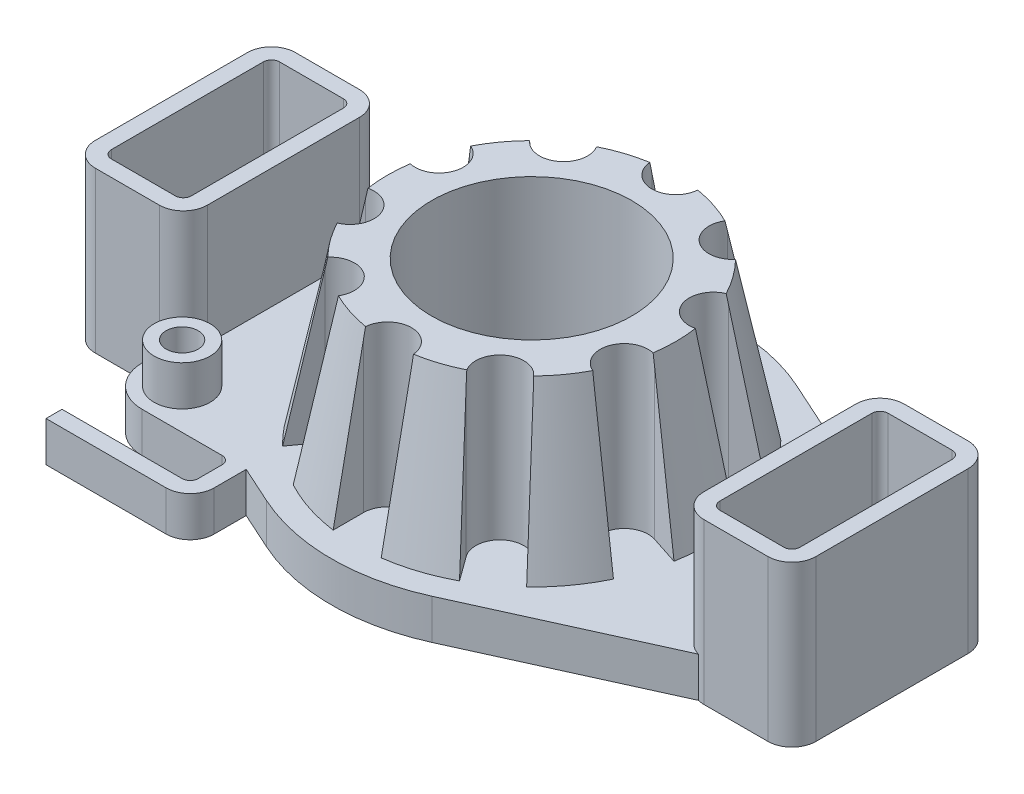
from build123d import *

# Parameters (mm, degrees)
SKETCH1_R               = 25
SKETCH1_R_2             = 12.5
SKETCH1_W               = 12
SKETCH1_H               = 25
BOSS_EXTRUDE1_DEPTH     = 5
CUT_EXTRUDE1_START      = -20
CUT_EXTRUDE1_DEPTH      = 20
CIRPATTERN1_COUNT       = 10
SKETCH4_W               = 14
SKETCH4_H               = 25
SKETCH4_W_2             = 10
SKETCH4_H_2             = 21
BOSS_EXTRUDE2_DEPTH     = 15
SKETCH4_3_W             = 10
SKETCH4_3_H             = 21
CUT_EXTRUDE4_DEPTH      = 56.226805122
BOSS_EXTRUDE3_DEPTH     = 5
FILLET1_R               = 3
FILLET2_R               = 1
FILLET3_R               = 5
SKETCH6_R               = 3.5
SKETCH6_R_2             = 2
BOSS_EXTRUDE4_DEPTH     = 10
CUT_EXTRUDE3_DEPTH      = 59.434495435
CUT_EXTRUDE3_DEPTH_BACK = 59.434495435
SKETCH6_2_R             = 2


# Read off the part's stored shape, not the designer's step: Cut-Extrude1
with BuildPart() as part:
    # Sketch1 → Boss-Extrude1 (new body)
    # profile 1 of 5: a face of its own
    with BuildSketch(Plane(origin=(0, 0, 0), x_dir=(1, 0, 0), z_dir=(0, 1, 0))):
        Circle(SKETCH1_R)
        with Locations(Location((0, 0, 0), (0, 0, 270))):
            Circle(SKETCH1_R_2, mode=Mode.SUBTRACT)
    # profile 2 of 5: a face of its own
    with BuildSketch(Plane(origin=(0, 0, 0), x_dir=(1, 0, 0), z_dir=(0, 1, 0))):
        with BuildLine():
            Line((33, 12.5), (10.312984639, 22.773720553))
            ThreePointArc((10.312984639, 22.773720553), (21.009814563, 13.549453569), (25, 0))
            ThreePointArc((25, 0), (21.009814563, -13.549453569), (10.312984639, -22.773720553))
            Line((10.312984639, -22.773720553), (33, -12.5))
            Line((33, -12.5), (33, 12.5))
        make_face()
    # profile 3 of 5: a face of its own
    with BuildSketch(Plane(origin=(0, 0, 0), x_dir=(1, 0, 0), z_dir=(0, 1, 0))):
        with Locations((39, 0)):
            Rectangle(SKETCH1_W, SKETCH1_H)
    # profile 4 of 5: a face of its own
    with BuildSketch(Plane(origin=(0, 0, 0), x_dir=(1, 0, 0), z_dir=(0, 1, 0))):
        with BuildLine():
            Line((-10.312984639, 22.773720553), (-33, 12.5))
            Line((-33, 12.5), (-33, -12.5))
            Line((-33, -12.5), (-10.312984639, -22.773720553))
            ThreePointArc((-10.312984639, -22.773720553), (-25, 0), (-10.312984639, 22.773720553))
        make_face()
    # profile 5 of 5: a face of its own
    with BuildSketch(Plane(origin=(0, 0, 0), x_dir=(1, 0, 0), z_dir=(0, 1, 0))):
        with Locations((-39, 0)):
            Rectangle(SKETCH1_W, SKETCH1_H)
    extrude(amount=BOSS_EXTRUDE1_DEPTH)

    # Sketch2 → Revolve1 (revolve)
    with BuildSketch(Plane.XY, mode=Mode.PRIVATE) as revolve1_sk:
        Polygon((12.5, 5), (12.5, 25), (18, 25), (22, 5), align=None)
    revolve(revolve1_sk.sketch.rotate(Axis((0, 0, 0), (0, 1, 0)), 90), axis=Axis((0, 0, 0), (0, 1, 0)))

    # Cut-Extrude1 outline → Cut-Extrude1 (cut)
    with BuildSketch(Plane(origin=(0, 25, 0), x_dir=(1, 0, 0), z_dir=(0, 1, 0)).offset(CUT_EXTRUDE1_START)):
        with BuildLine():
            ThreePointArc((-3, 18), (0, 15), (3, 18))
            Line((3, 18), (3, 22))
            Line((3, 22), (-3, 22))
            Line((-3, 22), (-3, 18))
        make_face()
    cut_extrude1 = extrude(amount=CUT_EXTRUDE1_DEPTH, mode=Mode.SUBTRACT)

    # CirPattern1: Cut-Extrude1 ×10 about axis
    cirpattern1_axis = Axis((0, 0, 0), (0, 1, 0))
    for i in range(1, CIRPATTERN1_COUNT):
        add(cut_extrude1.rotate(cirpattern1_axis, i * 360 / CIRPATTERN1_COUNT), mode=Mode.SUBTRACT)

    # Sketch4 → Boss-Extrude2 (add)
    # profile 1 of 2: a face of its own
    with BuildSketch(Plane(origin=(0, 5, 0), x_dir=(1, 0, 0), z_dir=(0, 1, 0))):
        with Locations((-38, 0)):
            Rectangle(SKETCH4_W, SKETCH4_H)
        with Locations((-38, 0)):
            Rectangle(SKETCH4_W_2, SKETCH4_H_2, mode=Mode.SUBTRACT)
    # profile 2 of 2: a face of its own
    with BuildSketch(Plane(origin=(0, 5, 0), x_dir=(1, 0, 0), z_dir=(0, 1, 0))):
        with Locations((38, 0)):
            Rectangle(SKETCH4_W, SKETCH4_H)
        with Locations((38, 0)):
            Rectangle(SKETCH4_W_2, SKETCH4_H_2, mode=Mode.SUBTRACT)
    extrude(amount=BOSS_EXTRUDE2_DEPTH)

    # Sketch4<3> → Cut-Extrude4 (cut, through all)
    with BuildSketch(Plane(origin=(0, 5, 0), x_dir=(1, 0, 0), z_dir=(0, 1, 0))):
        with Locations((-38, 0)):
            Rectangle(SKETCH4_3_W, SKETCH4_3_H)
        with Locations((38, 0)):
            Rectangle(SKETCH4_3_W, SKETCH4_3_H)
    extrude(amount=-CUT_EXTRUDE4_DEPTH, mode=Mode.SUBTRACT)

    # Sketch5 → Boss-Extrude3 (add)
    with BuildSketch(Plane(origin=(0, 0, 0), x_dir=(1, 0, 0), z_dir=(0, 1, 0))):
        Polygon((-33, -20.65122514), (-17, -20.65122514), (-17, -25.65122514), (-33, -25.65122514), (-33, -27.65122514), (-15, -27.65122514), (-15, -20.65122514), (-33, -12.5), align=None)
    extrude(amount=BOSS_EXTRUDE3_DEPTH)

    # Fillet1
    fillet1_edges = [part.edges().sort_by_distance(p)[0] for p in [
        (45, 10, -12.5),
        (45, 10, 12.5),
        (-45, 10, -12.5),
        (-45, 10, 12.5),
        (-15, 2.5, 27.65122514),
        (31, 12.5, 12.5),
        (31, 12.5, -12.5),
        (-31, 12.5, -12.5),
        (-31, 12.5, 12.5),
    ]]
    fillet(fillet1_edges, radius=FILLET1_R)

    # Fillet2
    fillet2_edges = [part.edges().sort_by_distance(p)[0] for p in [
        (-43, 10, -10.5),
        (-43, 10, 10.5),
        (-33, 10, 10.5),
        (-33, 10, -10.5),
        (33, 10, -10.5),
        (33, 10, 10.5),
        (43, 10, 10.5),
        (43, 10, -10.5),
        (-17, 2.5, 20.65122514),
        (-17, 2.5, 25.65122514),
    ]]
    fillet(fillet2_edges, radius=FILLET2_R)

    # Fillet3
    fillet3_edges = [part.edges().sort_by_distance(p)[0] for p in [
        (-33, 2.5, 20.65122514),
    ]]
    fillet(fillet3_edges, radius=FILLET3_R)

    # Sketch6 → Boss-Extrude4 (add)
    with BuildSketch(Plane(origin=(0, 0, 0), x_dir=(1, 0, 0), z_dir=(0, 1, 0))):
        with Locations(Location((-28, -15.65122514, 0), (0, 0, 270))):
            Circle(SKETCH6_R)
        with Locations(Location((-28, -15.65122514, 0), (0, 0, 270))):
            Circle(SKETCH6_R_2, mode=Mode.SUBTRACT)
    extrude(amount=BOSS_EXTRUDE4_DEPTH)

    # Sketch6<2> → Cut-Extrude3 (cut, two sides: drawn at the far end of the back side and taken through both)
    with BuildSketch(Plane(origin=(0, 0, 0), x_dir=(1, 0, 0), z_dir=(0, 1, 0)).offset(-CUT_EXTRUDE3_DEPTH_BACK)):
        with Locations(Location((-28, -15.65122514, 0), (0, 0, 270))):
            Circle(SKETCH6_2_R)
    extrude(amount=CUT_EXTRUDE3_DEPTH + CUT_EXTRUDE3_DEPTH_BACK, mode=Mode.SUBTRACT)


solid = part.part
